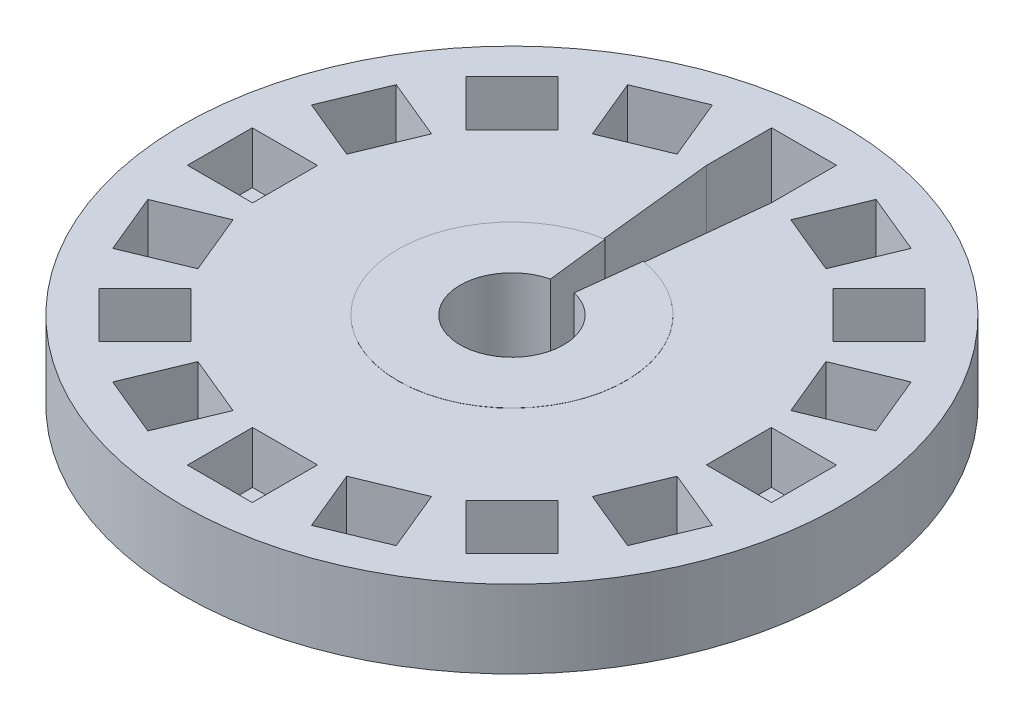
from build123d import *

# Parameters (mm, degrees)
SKETCH1_R                = 63.5
BOSS_EXTRUDE1_DEPTH      = 14.973360437
SKETCH2_W                = 12.5
SKETCH2_H                = 12.56
CUT_EXTRUDE1_DEPTH       = 10
CIRPATTERN1_COUNT        = 16
CUT_EXTRUDE3_DEPTH       = 37
CUT_EXTRUDE3_DEPTH_BACK  = 31
SKETCH5_W                = 12.5
SKETCH5_H                = 12.56
CUT_EXTRUDE4_DEPTH       = 26
CUT_EXTRUDE4_DEPTH_BACK  = 37
SKETCH6_R                = 17.625930659
CUT_EXTRUDE9_DEPTH       = 19
CUT_EXTRUDE9_DEPTH_BACK  = 11
BOSS_EXTRUDE4_DEPTH      = 15
BOSS_EXTRUDE4_DEPTH_BACK = 18
SKETCH13_R               = 21.952850423
CUT_EXTRUDE11_DEPTH      = 33
CUT_EXTRUDE11_DEPTH_BACK = 29
SKETCH16_R               = 9.976383377
CUT_EXTRUDE15_DEPTH      = 27
CUT_EXTRUDE15_DEPTH_BACK = 29


with BuildPart() as part:
    # Sketch1 → Boss-Extrude1 (new body)
    with BuildSketch(Plane(origin=(0, 0, 0), x_dir=(1, 0, 0), z_dir=(0, 1, 0))):
        Circle(SKETCH1_R)
    extrude(amount=BOSS_EXTRUDE1_DEPTH)

    # Sketch2 → Cut-Extrude1 (cut)
    with BuildSketch(Plane(origin=(0, 14.973360437, 0), x_dir=(1, 0, 0), z_dir=(0, 1, 0))):
        with Locations((0, -50)):
            Rectangle(SKETCH2_W, SKETCH2_H)
    cut_extrude1 = extrude(amount=-CUT_EXTRUDE1_DEPTH, mode=Mode.SUBTRACT)

    # CirPattern1: Cut-Extrude1 ×16 about axis
    cirpattern1_axis = Axis((0, 14.973360437, 0), (0, -1, 0))
    for i in range(1, CIRPATTERN1_COUNT):
        add(cut_extrude1.rotate(cirpattern1_axis, i * 360 / CIRPATTERN1_COUNT), mode=Mode.SUBTRACT)

    # Sketch5 → Cut-Extrude3 (cut, two sides: drawn at the far end of the back side and taken through both)
    with BuildSketch(Plane(origin=(0, 0, 0), x_dir=(1, 0, 0), z_dir=(0, 1, 0)).offset(-CUT_EXTRUDE3_DEPTH_BACK)):
        with Locations((0, 50)):
            Rectangle(SKETCH5_W, SKETCH5_H)
    extrude(amount=CUT_EXTRUDE3_DEPTH + CUT_EXTRUDE3_DEPTH_BACK, mode=Mode.SUBTRACT)

    # Sketch6 → Cut-Extrude4 (cut, two sides: drawn at the far end of the back side and taken through both)
    with BuildSketch(Plane(origin=(0, 14.973360437, 0), x_dir=(1, 0, 0), z_dir=(0, 1, 0)).offset(-CUT_EXTRUDE4_DEPTH_BACK)):
        Circle(SKETCH6_R)
    extrude(amount=CUT_EXTRUDE4_DEPTH + CUT_EXTRUDE4_DEPTH_BACK, mode=Mode.SUBTRACT)

    # Sketch9 → Cut-Extrude9 (cut, two sides: drawn at the far end of the back side and taken through both)
    with BuildSketch(Plane(origin=(0, 0, 0), x_dir=(1, 0, 0), z_dir=(0, 1, 0)).offset(-CUT_EXTRUDE9_DEPTH_BACK)):
        Polygon((-6.25, 43.72), (0, -15.098638444), (6.25, 43.72), align=None)
    extrude(amount=CUT_EXTRUDE9_DEPTH + CUT_EXTRUDE9_DEPTH_BACK, mode=Mode.SUBTRACT)

    # Sketch13 → Boss-Extrude4 (add, two sides: drawn at the far end of the back side and taken through both)
    with BuildSketch(Plane(origin=(0, 0, 0), x_dir=(1, 0, 0), z_dir=(0, 1, 0)).offset(-BOSS_EXTRUDE4_DEPTH_BACK)):
        Circle(SKETCH13_R)
    extrude(amount=BOSS_EXTRUDE4_DEPTH + BOSS_EXTRUDE4_DEPTH_BACK)

    # Sketch16 → Cut-Extrude11 (cut, two sides: drawn at the far end of the back side and taken through both)
    with BuildSketch(Plane(origin=(0, 0, 0), x_dir=(1, 0, 0), z_dir=(0, 1, 0)).offset(-CUT_EXTRUDE11_DEPTH_BACK)):
        Circle(SKETCH16_R)
    extrude(amount=CUT_EXTRUDE11_DEPTH + CUT_EXTRUDE11_DEPTH_BACK, mode=Mode.SUBTRACT)

    # Sketch17 → Cut-Extrude15 (cut, two sides: drawn at the far end of the back side and taken through both)
    with BuildSketch(Plane(origin=(0, 0, 0), x_dir=(1, 0, 0), z_dir=(0, 1, 0)).offset(-CUT_EXTRUDE15_DEPTH_BACK)):
        Polygon((-6.25, 43.72), (0, -9.976383377), (6.25, 43.72), align=None)
    extrude(amount=CUT_EXTRUDE15_DEPTH + CUT_EXTRUDE15_DEPTH_BACK, mode=Mode.SUBTRACT)


solid = part.part
